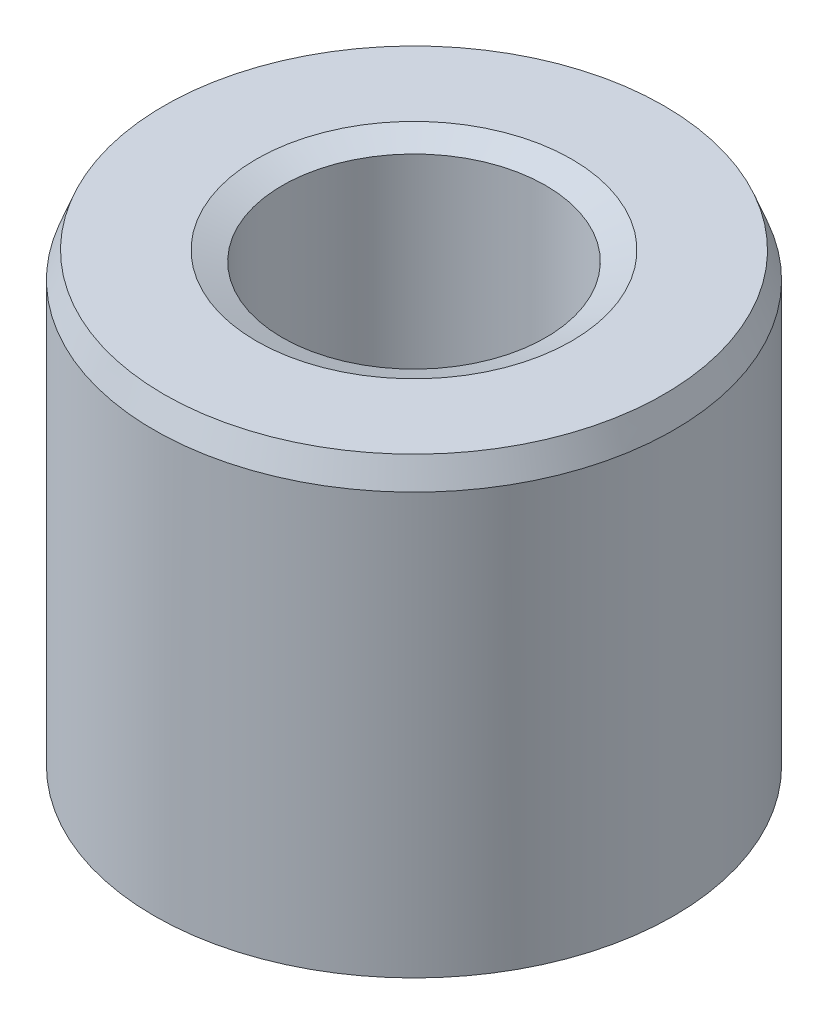
from build123d import *
from OCP.BRepFilletAPI import BRepFilletAPI_MakeChamfer

# Parameters (mm, degrees)
SKETCH1_R           = 30
BOSS_EXTRUDE1_DEPTH = 52.691831053
SKETCH2_R           = 15.20752149
CUT_EXTRUDE1_DEPTH  = 68.649309381
CHAMFER1_SIZE       = 2.986974702
CHAMFER1_SIZE2      = 1.146675134


with BuildPart() as part:
    # Sketch1 → Boss-Extrude1 (new body)
    with BuildSketch(Plane(origin=(0, 0, 0), x_dir=(1, 0, 0), z_dir=(0, 1, 0))):
        Circle(SKETCH1_R)
    extrude(amount=BOSS_EXTRUDE1_DEPTH)

    # Sketch2 → Cut-Extrude1 (cut, through all)
    with BuildSketch(Plane(origin=(0, 0, 0), x_dir=(1, 0, 0), z_dir=(0, 1, 0))):
        Circle(SKETCH2_R)
    extrude(amount=CUT_EXTRUDE1_DEPTH, mode=Mode.SUBTRACT)

    # Chamfer1: one chamfer whose edges measure the first distance from different faces: ONE call of the kernel's chamfer builder (chamfer() names one face for all edges)
    chamfer1_edges_1 = [part.edges().sort_by_distance(p)[0] for p in [
        (-15.20752149, 52.691831053, 0),
    ]]
    chamfer1_side_1 = [part.faces().sort_by_distance(p)[0] for p in [
        (-29.151471863, 52.691831053, 0),
    ]]
    chamfer1_edges_2 = [part.edges().sort_by_distance(p)[0] for p in [
        (-15.20752149, 0, 0),
    ]]
    chamfer1_side_2 = [part.faces().sort_by_distance(p)[0] for p in [
        (-15.20752149, 26.345915526, 0),
    ]]
    chamfer1_edges_3 = [part.edges().sort_by_distance(p)[0] for p in [
        (-30, 0, 0),
    ]]
    chamfer1_side_3 = [part.faces().sort_by_distance(p)[0] for p in [
        (-29.151471863, 0, 0),
    ]]
    chamfer1_edges_4 = [part.edges().sort_by_distance(p)[0] for p in [
        (-30, 52.691831053, 0),
    ]]
    chamfer1_side_4 = [part.faces().sort_by_distance(p)[0] for p in [
        (-30, 26.345915526, 0),
    ]]
    chamfer1 = BRepFilletAPI_MakeChamfer(part.part.solid().wrapped)
    for e in chamfer1_edges_1:
        chamfer1.Add(CHAMFER1_SIZE, CHAMFER1_SIZE2, e.wrapped, chamfer1_side_1[0].wrapped)  # the first distance lies on this face
    for e in chamfer1_edges_2:
        chamfer1.Add(CHAMFER1_SIZE, CHAMFER1_SIZE2, e.wrapped, chamfer1_side_2[0].wrapped)  # the first distance lies on this face
    for e in chamfer1_edges_3:
        chamfer1.Add(CHAMFER1_SIZE, CHAMFER1_SIZE2, e.wrapped, chamfer1_side_3[0].wrapped)  # the first distance lies on this face
    for e in chamfer1_edges_4:
        chamfer1.Add(CHAMFER1_SIZE, CHAMFER1_SIZE2, e.wrapped, chamfer1_side_4[0].wrapped)  # the first distance lies on this face
    add(Compound.cast(chamfer1.Shape()), mode=Mode.REPLACE)


solid = part.part
